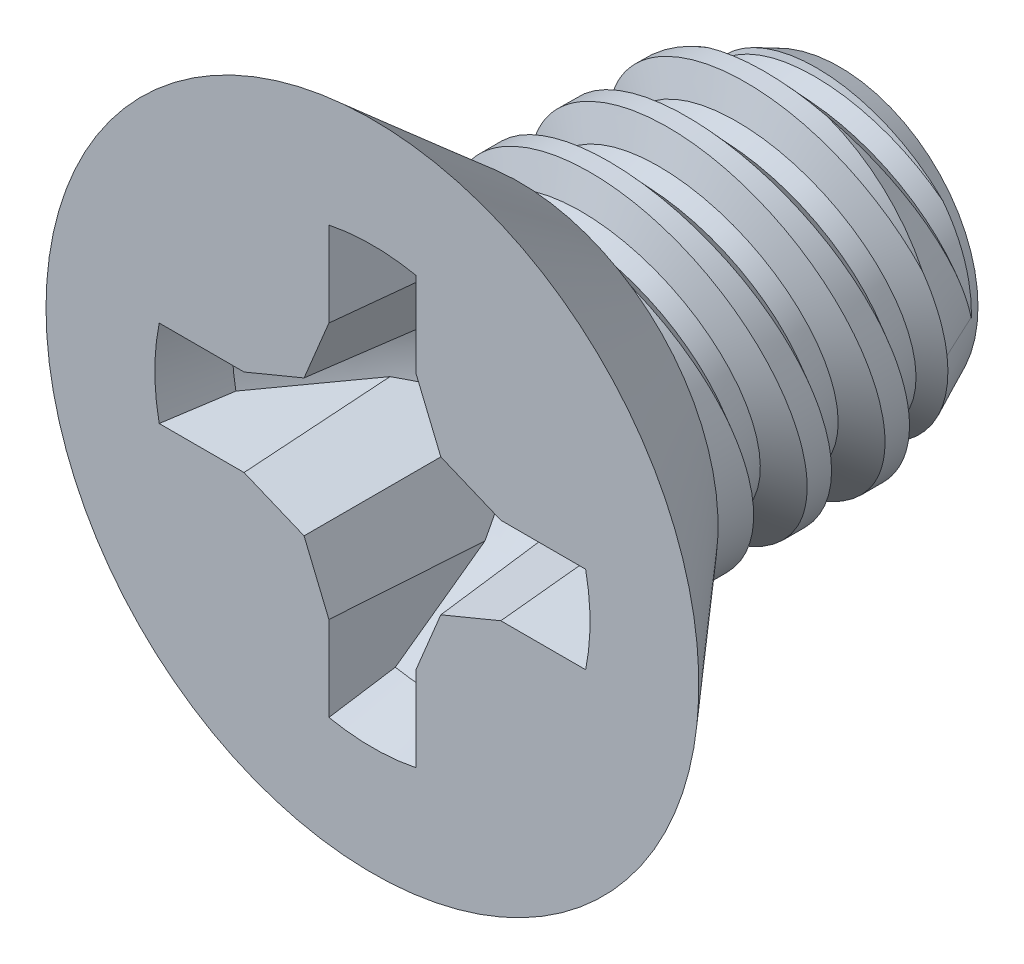
from build123d import *

# Parameters (mm, degrees)
SKETCH1_R          = 3.3274
EXTRUDE3_DEPTH     = 1.4986
SKETCH4_W          = 3.2639
SKETCH4_H          = 1.7526
LPATTERN2_COUNT    = 4
LPATTERN2_PITCH    = 0.79375
CUT_EXTRUDE3_REACH = 8.695
CIRPATTERN1_COUNT  = 4
DRAFT2_ANGLE       = 5


# Read off the part's stored shape, not the designer's step: Draft1
with BuildPart() as part:
    # Sketch1 → Extrude3 (new body)
    with BuildSketch(Plane.XY):
        with Locations(Location((0, 0, 0), (0, 0, 180))):
            Circle(SKETCH1_R)
    extrude(amount=EXTRUDE3_DEPTH)

    # Sketch11 → Cut-Revolve3 (revolve, cut)
    with BuildSketch(Plane(origin=(0, 0, 0), x_dir=(0, 0, -1), z_dir=(1, 0, 0)), mode=Mode.PRIVATE) as cut_revolve3_sk:
        Polygon((0, 2.024687), (-1.4986, 3.3274), (0, 3.3274), align=None)
    revolve(cut_revolve3_sk.sketch.rotate(Axis((0, 0, -0.441444), (0, 0, 1)), 90), axis=Axis((0, 0, -0.441444), (0, 0, 1)), mode=Mode.SUBTRACT)

    # Sketch4 → Revolve1 (revolve)
    with BuildSketch(Plane(origin=(0, 0, 0), x_dir=(0, 0, -1), z_dir=(1, 0, 0)), mode=Mode.PRIVATE) as revolve1_sk:
        with Locations((1.63195, 0.8763)):
            Rectangle(SKETCH4_W, SKETCH4_H)
    revolve(revolve1_sk.sketch.rotate(Axis((0, 0, -3.2639), (0, 0, -1)), 90), axis=Axis((0, 0, -3.2639), (0, 0, -1)))

    # Sketch5 → Cut-Revolve1 (revolve, cut)
    with BuildSketch(Plane(origin=(0, 0, 0), x_dir=(0, 0, -1), z_dir=(1, 0, 0)), mode=Mode.PRIVATE) as cut_revolve1_sk:
        Polygon((0.096769, 1.774513), (0.433577, 1.410276), (0.627114, 1.454102), (0.774149, 1.927906), align=None)
    cut_revolve1 = revolve(cut_revolve1_sk.sketch.rotate(Axis((0, -0.193538, 0), (0, 0.22085736379914167, -0.9753061185369923)), 180), axis=Axis((0, -0.193538, 0), (0, 0.22085736379914167, -0.9753061185369923)), mode=Mode.SUBTRACT)

    # Sketch13 → Cut-Revolve4 (revolve, cut)
    with BuildSketch(Plane(origin=(0, 0, 0), x_dir=(0, 0, -1), z_dir=(1, 0, 0)), mode=Mode.PRIVATE) as cut_revolve4_sk:
        Polygon((3.2639, 1.410276), (2.529783, 1.7526), (3.2639, 1.7526), align=None)
    revolve(cut_revolve4_sk.sketch.rotate(Axis((0, 0, 0), (0, 0, -1)), 90), axis=Axis((0, 0, 0), (0, 0, -1)), mode=Mode.SUBTRACT)

    # LPattern2: Cut-Revolve1 ×4
    with Locations(*[(0, 0, -i * LPATTERN2_PITCH) for i in range(1, LPATTERN2_COUNT)]):
        add(cut_revolve1, mode=Mode.SUBTRACT)

    # Cut-Extrude3: up to this cone (the profile starts inside it)
    cut_extrude3_end = Plane(origin=(0, 0, 1.4986), z_dir=(0, 0, 1)).offset(-2.982435) * Cone(1e-06, 12.839389, 14.770027, align=(Align.CENTER, Align.CENTER, Align.MIN), mode=Mode.PRIVATE)
    # Sketch12 → Cut-Extrude3 (cut, up to the surface)
    with BuildSketch(Plane.XY.offset(1.4986), mode=Mode.PRIVATE) as cut_extrude3_sk1:
        with BuildLine():
            Line((2.173449, 0.443653), (1.308551, 0.443653))
            Line((1.308551, 0.443653), (0.696976, 0.696976))
            Line((0.696976, 0.696976), (0.443653, 1.308551))
            Line((0.443653, 1.308551), (0.443653, 2.173449))
            ThreePointArc((0.443653, 2.173449), (0.222956, 2.207034), (0, 2.218267))
            Line((0, 2.218267), (0, 0))
            Line((0, 0), (2.218267, 0))
            ThreePointArc((2.218267, 0), (2.207034, 0.222956), (2.173449, 0.443653))
        make_face()
    cut_extrude3_tool1 = extrude(cut_extrude3_sk1.sketch, amount=-CUT_EXTRUDE3_REACH, mode=Mode.PRIVATE) & cut_extrude3_end
    cut_extrude3 = cut_extrude3_tool1.solids().sort_by_distance((1.741, 0.412282, 1.4986))[0]
    add(cut_extrude3, mode=Mode.SUBTRACT)

    # CirPattern1: Cut-Extrude3 ×4 about axis
    cirpattern1_axis = Axis((0, 0, 0), (0, 0, 1))
    for i in range(1, CIRPATTERN1_COUNT):
        add(cut_extrude3.rotate(cirpattern1_axis, i * 360 / CIRPATTERN1_COUNT), mode=Mode.SUBTRACT)

    # Draft1 outline → Draft1 (revolve)
    with BuildSketch(Plane.XZ):
        Polygon((2.218267, 1.4986), (2.051472, 0.876112), (2.218267, 0.876112), align=None)
    revolve(axis=Axis((0, 0, 0), (0, 0, 1)))

    # Draft2
    draft2_faces = [part.faces().sort_by_distance(p)[0] for p in [
        (0.443653, 1.643117, 0.991925),
        (0.576226, 0.988492, 0.671243),
        (0.988492, 0.576226, 0.671243),
        (1.643117, 0.443653, 0.991925),
        (1.643117, -0.443653, 0.991925),
        (0.988492, -0.576226, 0.671243),
        (0.576226, -0.988492, 0.671243),
        (0.443653, -1.643117, 0.991925),
        (-0.443653, -1.643117, 0.991925),
        (-0.576226, -0.988492, 0.671243),
        (-0.988492, -0.576226, 0.671243),
        (-1.643117, -0.443653, 0.991925),
        (-1.643117, 0.443653, 0.991925),
        (-0.988492, 0.576226, 0.671243),
        (-0.576226, 0.988492, 0.671243),
        (-0.443653, 1.643117, 0.991925),
    ]]
    draft(draft2_faces, Plane.XY.offset(1.4986), DRAFT2_ANGLE)


solid = part.part
